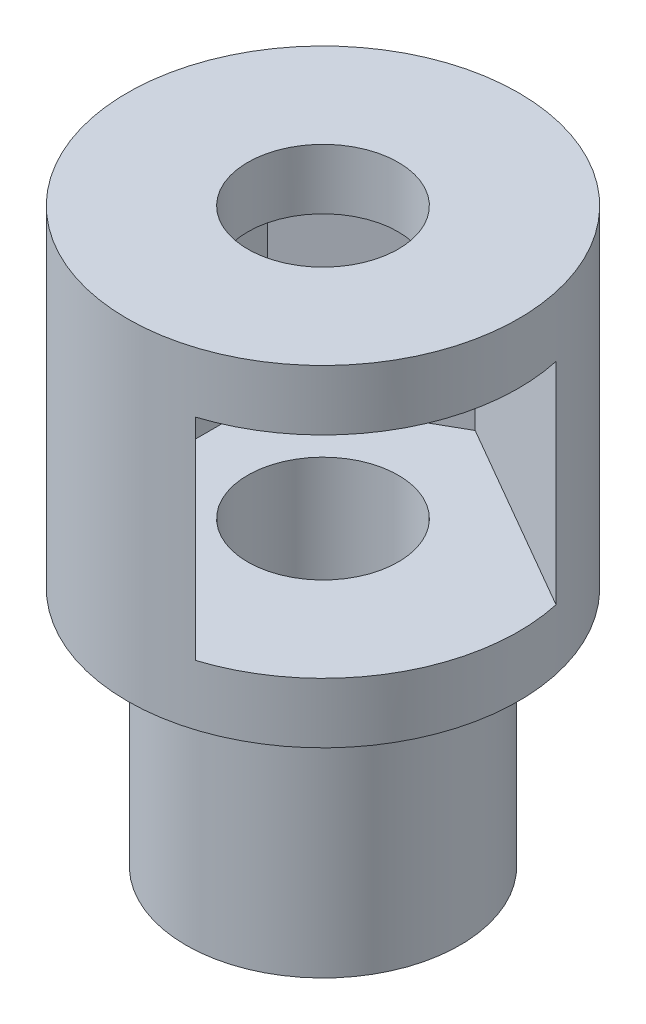
from build123d import *

# Parameters (mm, degrees)
SKETCH1_R           = 4.55
BOSS_EXTRUDE1_DEPTH = 8
SKETCH2_R           = 2.5
CUT_EXTRUDE1_DEPTH  = 8
SKETCH3_R           = 6.5
BOSS_EXTRUDE4_DEPTH = 9
CUT_EXTRUDE2_DEPTH  = 7
SKETCH6_R           = 6.5
BOSS_EXTRUDE5_DEPTH = 2
SKETCH7_R           = 2.5
CUT_EXTRUDE3_DEPTH  = 22.106870919


with BuildPart() as part:
    # Sketch1 → Boss-Extrude1 (new body)
    with BuildSketch(Plane(origin=(0, 0, 0), x_dir=(1, 0, 0), z_dir=(0, 1, 0))):
        Circle(SKETCH1_R)
    extrude(amount=BOSS_EXTRUDE1_DEPTH)

    # Sketch2 → Cut-Extrude1 (cut)
    with BuildSketch(Plane(origin=(0, 8, 0), x_dir=(1, 0, 0), z_dir=(0, 1, 0))):
        Circle(SKETCH2_R)
    extrude(amount=-CUT_EXTRUDE1_DEPTH, mode=Mode.SUBTRACT)

    # Sketch3 → Boss-Extrude4 (add)
    with BuildSketch(Plane(origin=(0, 8, 0), x_dir=(1, 0, 0), z_dir=(0, 1, 0))):
        Circle(SKETCH3_R)
    extrude(amount=BOSS_EXTRUDE4_DEPTH)

    # Sketch5 → Cut-Extrude2 (cut)
    with BuildSketch(Plane(origin=(0, 17, 0), x_dir=(1, 0, 0), z_dir=(0, 1, 0))):
        Polygon((-4.406153459, -2.521016119), (-4.406153459, 2.55966625), (-0.006153459, 5.061357304), (7.819258761, 0.543353452), (3.435994759, -7.048682503), align=None)
    extrude(amount=-CUT_EXTRUDE2_DEPTH, mode=Mode.SUBTRACT)

    # Sketch6 → Boss-Extrude5 (add)
    with BuildSketch(Plane(origin=(0, 17, 0), x_dir=(1, 0, 0), z_dir=(0, 1, 0))):
        Circle(SKETCH6_R)
    extrude(amount=BOSS_EXTRUDE5_DEPTH)

    # Sketch7 → Cut-Extrude3 (cut, through all)
    with BuildSketch(Plane.XZ):
        Circle(SKETCH7_R)
    extrude(amount=-CUT_EXTRUDE3_DEPTH, mode=Mode.SUBTRACT)


solid = part.part
